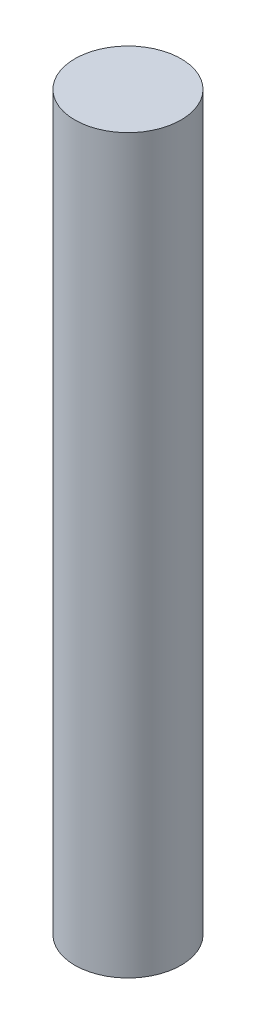
from build123d import *

# Parameters (mm, degrees)
SKETCH1_R           = 2.9
BOSS_EXTRUDE1_DEPTH = 40


with BuildPart() as part:
    # Sketch1 → Boss-Extrude1 (new body)
    with BuildSketch(Plane(origin=(0, 0, 0), x_dir=(1, 0, 0), z_dir=(0, 1, 0))):
        Circle(SKETCH1_R)
    extrude(amount=BOSS_EXTRUDE1_DEPTH)


solid = part.part
